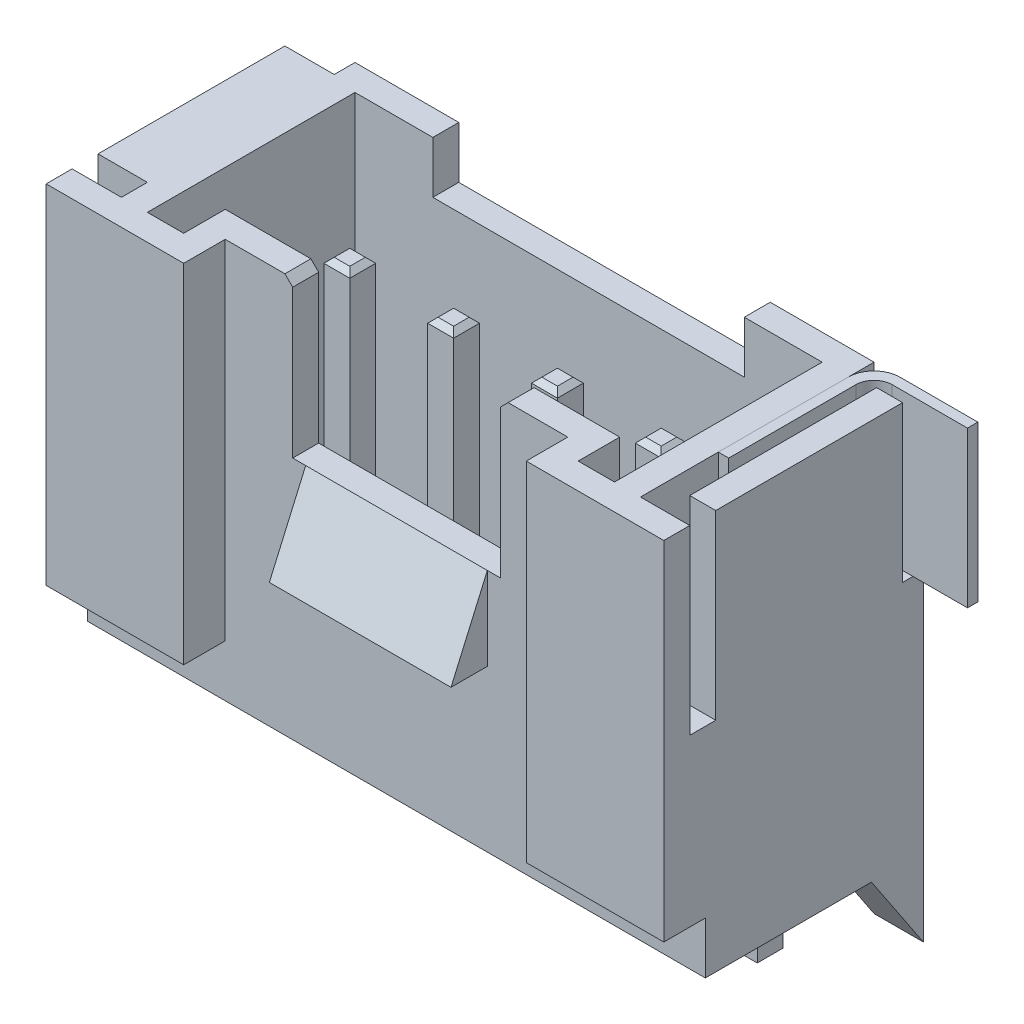
from build123d import *

# Parameters (mm, degrees)
ESQUISSE1_W                             = 10
ESQUISSE1_H                             = 5
BOSS_EXTRU_1_DEPTH                      = 7.7
ESQUISSE7_W                             = 0.8
ESQUISSE7_H                             = 1
ENL_V_MAT_EXTRU_5_DEPTH                 = 14.575345299
ESQUISSE2_W                             = 6.6
ESQUISSE2_H                             = 1.6
ENL_V_MAT_EXTRU_1_DEPTH                 = 11.454185765
ENL_V_MAT_EXTRU_2_DEPTH                 = 6.5
ESQUISSE5_W                             = 6
ESQUISSE5_H                             = 1
ENL_V_MAT_EXTRU_3_DEPTH                 = 1
ESQUISSE6_W                             = 4
ESQUISSE6_H                             = 1
ENL_V_MAT_EXTRU_4_DEPTH                 = 3
BOSS_EXTRU_2_DEPTH                      = 1.75
CHANFREIN1_SIZE                         = 0.15
EXTRU_MINCE4_START                      = -0.25
EXTRU_MINCE4_OUTLINE_W                  = 0.5
EXTRU_MINCE4_OUTLINE_H                  = 5.3
EXTRU_MINCE4_DEPTH                      = 0.5
CHANFREIN6_SIZE                         = 0.1
R_P_TITION_LIN_AIRE8_COUNT              = 4
R_P_TITION_LIN_AIRE8_PITCH              = 2
CHANFREIN6_OF_R_P_TITION_LIN_AIRE8_SIZE = 0.1
BOSS_EXTRU_3_DEPTH                      = 0.95
ESQUISSE19_W                            = 0.45
ESQUISSE19_H                            = 3.6
ENL_V_MAT_EXTRU_6_DEPTH                 = 3.5
BOSS_EXTRU_4_DEPTH                      = 3


# Read off the part's stored shape, not the designer's step: Extru.-Mince4
with BuildPart() as part:
    # Esquisse1 → Boss.-Extru.1 (new body)
    with BuildSketch(Plane(origin=(0, 0, 0), x_dir=(1, 0, 0), z_dir=(0, 1, 0))):
        with Locations((0, 2.5)):
            Rectangle(ESQUISSE1_W, ESQUISSE1_H)
    extrude(amount=BOSS_EXTRU_1_DEPTH)

    # Esquisse7 → Enlèv. mat.-Extru.5 (cut, through all)
    with BuildSketch(Plane(origin=(5, 0, 0), x_dir=(0, 0, -1), z_dir=(1, 0, 0))):
        with Locations((0.4, 0.5)):
            Rectangle(ESQUISSE7_W, ESQUISSE7_H)
    extrude(amount=-ENL_V_MAT_EXTRU_5_DEPTH, mode=Mode.SUBTRACT)

    # Esquisse2 → Enlèv. mat.-Extru.1 (cut, through all)
    with BuildSketch(Plane(origin=(0, 7.7, 0), x_dir=(1, 0, 0), z_dir=(0, 1, 0))):
        Rectangle(ESQUISSE2_W, ESQUISSE2_H)
    extrude(amount=-ENL_V_MAT_EXTRU_1_DEPTH, mode=Mode.SUBTRACT)

    # Esquisse4 → Enlèv. mat.-Extru.2 (cut)
    with BuildSketch(Plane(origin=(0, 7.7, 0), x_dir=(1, 0, 0), z_dir=(0, 1, 0))):
        Polygon((-3.8, 1.3), (3.8, 1.3), (3.8, 0.5), (4.5, 0.5), (4.5, 4.5), (-4.5, 4.5), (-4.5, 0.5), (-3.8, 0.5), align=None)
    extrude(amount=-ENL_V_MAT_EXTRU_2_DEPTH, mode=Mode.SUBTRACT)

    # Esquisse5 → Enlèv. mat.-Extru.3 (cut)
    with BuildSketch(Plane(origin=(0, 7.7, 0), x_dir=(1, 0, 0), z_dir=(0, 1, 0))):
        with Locations((0, 4.5)):
            Rectangle(ESQUISSE5_W, ESQUISSE5_H)
    extrude(amount=-ENL_V_MAT_EXTRU_3_DEPTH, mode=Mode.SUBTRACT)

    # Esquisse6 → Enlèv. mat.-Extru.4 (cut)
    with BuildSketch(Plane(origin=(0, 7.7, 0), x_dir=(1, 0, 0), z_dir=(0, 1, 0))):
        with Locations((0, 0.8)):
            Rectangle(ESQUISSE6_W, ESQUISSE6_H)
    extrude(amount=-ENL_V_MAT_EXTRU_4_DEPTH, mode=Mode.SUBTRACT)

    # Esquisse11 → Boss.-Extru.2 (add, symmetric)
    with BuildSketch(Plane(origin=(0, 0, 0), x_dir=(0, 0, -1), z_dir=(1, 0, 0))):
        Polygon((0.8, 4.7), (0.1, 3.1), (0.8, 3.1), align=None)
    extrude(amount=BOSS_EXTRU_2_DEPTH, both=True)

    # Chanfrein1
    chanfrein1_edges = [part.edges().sort_by_distance(p)[0] for p in [
        (2, 7.7, -1.05),
        (-2, 7.7, -1.05),
    ]]
    chamfer(chanfrein1_edges, length=CHANFREIN1_SIZE)

    # Extru.-Mince4 outline → Extru.-Mince4 (add)
    with BuildSketch(Plane(origin=(3, 0, 0), x_dir=(0, 0, -1), z_dir=(1, 0, 0)).offset(EXTRU_MINCE4_START)):
        Polygon((2.65, -0.5), (4.5, -0.5), (4.5, -3.05), (5, -3.05), (5, 0), (2.65, 0), align=None)
        with Locations((2.9, 3.85)):
            Rectangle(EXTRU_MINCE4_OUTLINE_W, EXTRU_MINCE4_OUTLINE_H)
    extru_mince4 = extrude(amount=EXTRU_MINCE4_DEPTH)

    # Chanfrein6
    chanfrein6_edges = [part.edges().sort_by_distance(p)[0] for p in [
        (3, 6.5, -2.65),
        (2.75, 6.5, -2.9),
        (3.25, 6.5, -2.9),
        (3, 6.5, -3.15),
        (3.25, -3.05, -4.75),
        (3, -3.05, -4.5),
        (3, -3.05, -5),
        (2.75, -3.05, -4.75),
    ]]
    chamfer(chanfrein6_edges, length=CHANFREIN6_SIZE)

    # Répétition linéaire8: Extru.-Mince4 ×4
    with Locations(*[(-i * R_P_TITION_LIN_AIRE8_PITCH, 0, 0) for i in range(1, R_P_TITION_LIN_AIRE8_COUNT)]):
        add(extru_mince4)

    # Chanfrein6 of Répétition linéaire8
    chanfrein6_of_r_p_tition_lin_aire8_edges = [part.edges().sort_by_distance(p)[0] for p in [
        (1, 6.5, -2.65),
        (0.75, 6.5, -2.9),
        (1.25, 6.5, -2.9),
        (1, 6.5, -3.15),
        (1.25, -3.05, -4.75),
        (1, -3.05, -4.5),
        (1, -3.05, -5),
        (0.75, -3.05, -4.75),
        (-1, 6.5, -2.65),
        (-1.25, 6.5, -2.9),
        (-0.75, 6.5, -2.9),
        (-1, 6.5, -3.15),
        (-0.75, -3.05, -4.75),
        (-1, -3.05, -4.5),
        (-1, -3.05, -5),
        (-1.25, -3.05, -4.75),
        (-3, 6.5, -2.65),
        (-3.25, 6.5, -2.9),
        (-2.75, 6.5, -2.9),
        (-3, 6.5, -3.15),
        (-2.75, -3.05, -4.75),
        (-3, -3.05, -4.5),
        (-3, -3.05, -5),
        (-3.25, -3.05, -4.75),
    ]]
    chamfer(chanfrein6_of_r_p_tition_lin_aire8_edges, length=CHANFREIN6_OF_R_P_TITION_LIN_AIRE8_SIZE)

    # Esquisse18 → Boss.-Extru.3 (add)
    with BuildSketch(Plane(origin=(5, 0, 0), x_dir=(0, 0, -1), z_dir=(1, 0, 0))):
        Polygon((0, 7.7), (0, 1), (0.8, 1), (0.8, 0), (4, 0), (5, -1.5), (5, 0), (5, 4.7), (4.6, 4.7), (4.6, 7.7), (1, 7.7), (1, 4.2), (0.5, 4.2), (0.5, 7.7), align=None)
    boss_extru_3 = extrude(amount=BOSS_EXTRU_3_DEPTH)

    # Symétrie1: Boss.-Extru.3 across plane
    add(boss_extru_3.mirror(Plane(origin=(0, 0, 0), x_dir=(0, 0, 1), z_dir=(1, 0, 0))))

    # Esquisse19 → Enlèv. mat.-Extru.6 (cut)
    with BuildSketch(Plane(origin=(0, 7.7, 0), x_dir=(1, 0, 0), z_dir=(0, 1, 0))):
        with Locations((5.225, 2.8)):
            Rectangle(ESQUISSE19_W, ESQUISSE19_H)
    extrude(amount=-ENL_V_MAT_EXTRU_6_DEPTH, mode=Mode.SUBTRACT)


with BuildPart() as body_2:
    # Esquisse20 → Boss.-Extru.4 (new body)
    with BuildSketch(Plane(origin=(0, 4.7, 0), x_dir=(1, 0, 0), z_dir=(0, 1, 0))):
        with BuildLine():
            Line((5, 4.5), (5, 2))
            Line((5, 2), (5.2, 2))
            Line((5.2, 2), (5.2, 4.45))
            ThreePointArc((5.2, 4.45), (5.302512627, 4.697487373), (5.55, 4.8))
            Line((5.55, 4.8), (7, 4.8))
            Line((7, 4.8), (7, 5))
            Line((7, 5), (5.5, 5))
            ThreePointArc((5.5, 5), (5.146446609, 4.853553391), (5, 4.5))
        make_face()
    extrude(amount=BOSS_EXTRU_4_DEPTH)


solid = Compound([part.part, body_2.part])
